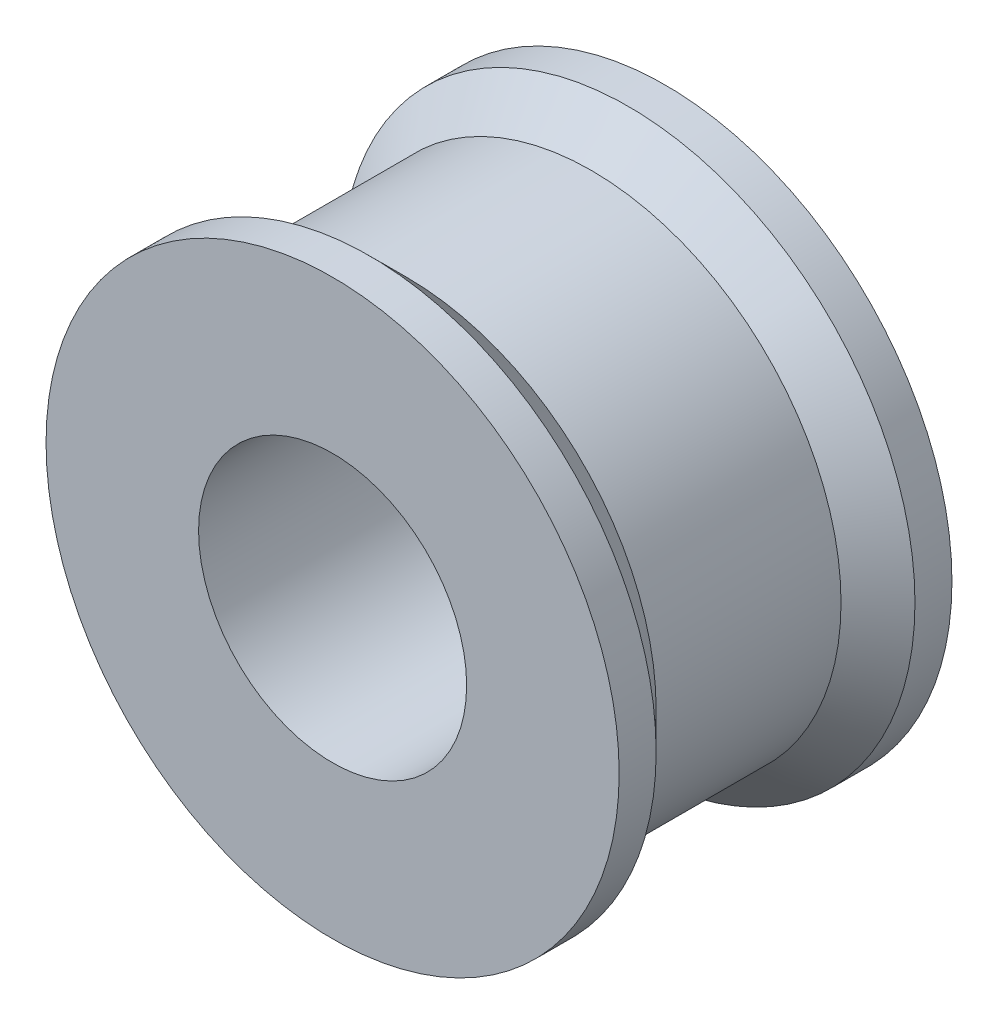
from build123d import *

# Parameters (mm, degrees)
SKETCH1_R           = 7.75
SKETCH1_R_2         = 3.625
BOSS_EXTRUDE1_DEPTH = 1
SKETCH2_R           = 6.75
SKETCH2_R_2         = 3.625
BOSS_EXTRUDE2_DEPTH = 3.5
CHAMFER1_SIZE       = 1


with BuildPart() as part:
    # Sketch1 → Boss-Extrude1 (new body)
    with BuildSketch(Plane.XY):
        Circle(SKETCH1_R)
        Circle(SKETCH1_R_2, mode=Mode.SUBTRACT)
    extrude(amount=BOSS_EXTRUDE1_DEPTH)

    # Sketch2 → Boss-Extrude2 (add)
    with BuildSketch(Plane.XY.offset(1)):
        Circle(SKETCH2_R)
        Circle(SKETCH2_R_2, mode=Mode.SUBTRACT)
    extrude(amount=BOSS_EXTRUDE2_DEPTH)

    # Chamfer1
    chamfer1_edges = [part.edges().sort_by_distance(p)[0] for p in [
        (-6.75, 0, 1),
    ]]
    chamfer(chamfer1_edges, length=CHAMFER1_SIZE - 0.0001)  # a hair under: the kernel refuses the full size

    # Mirror5: part across plane


with BuildPart() as part_1:
    add(part.part)
    add(part.part.mirror(Plane.XY.offset(4.5)))


solid = part_1.part
